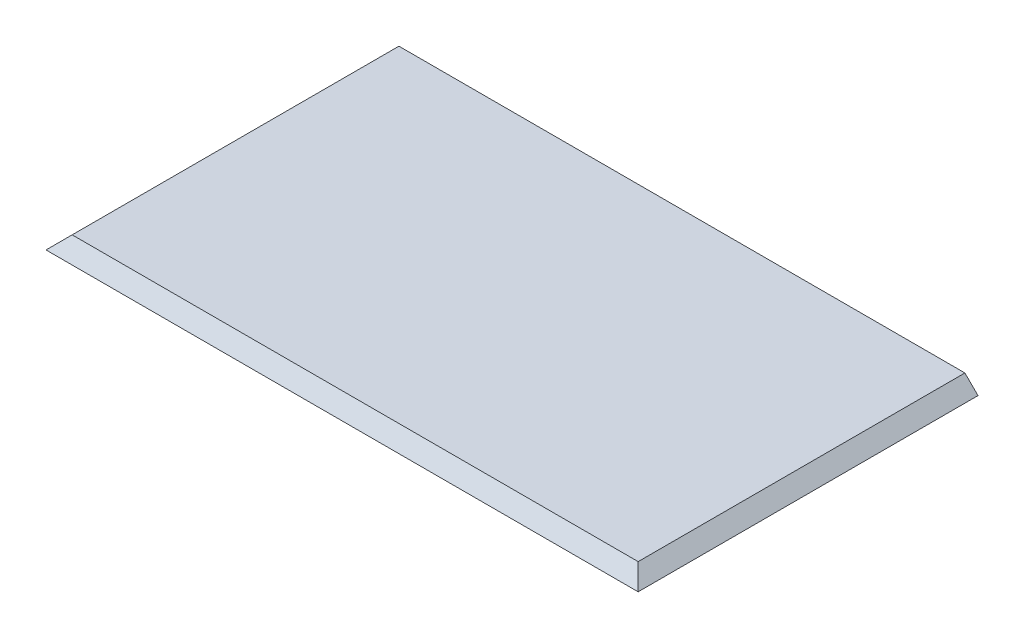
from build123d import *

# Parameters (mm, degrees)
SKETCH1_W           = 575
SKETCH1_H           = 330
BOSS_EXTRUDE1_DEPTH = 12.7
CHAMFER1_SIZE       = 12.7


with BuildPart() as part:
    # Sketch1 → Boss-Extrude1 (new body)
    with BuildSketch(Plane(origin=(0, 0, 0), x_dir=(1, 0, 0), z_dir=(0, 1, 0))):
        Rectangle(SKETCH1_W, SKETCH1_H)
    extrude(amount=BOSS_EXTRUDE1_DEPTH)

    # Chamfer1
    # the kernel refuses this chamfer: 12.7 mm, written as the material it takes off along each edge
    with BuildSketch(Plane(origin=(287.5, 12.7, -197.660373947), x_dir=(0.027495876610585654, -0.9996219169112966, 0), z_dir=(0, 0, 1)), Plane(origin=(-287.5, 12.7, 197.660373947), x_dir=(-0.027495876610585654, -0.9996219169112966, 0), z_dir=(0, 0, -1))) as chamfer1_piece_1:
        Polygon((CHAMFER1_SIZE * 0.999621916911, -CHAMFER1_SIZE * 0.0274958766106), (-CHAMFER1_SIZE * 0.0274958766106, -CHAMFER1_SIZE * 0.999621916911), (0, 0), align=None)
    extrude(amount=395.320747894, mode=Mode.SUBTRACT)
    with BuildSketch(Plane(origin=(320.160373947, 12.7, 165), x_dir=(0, -0.9996219169112966, 0.027495876610585654), z_dir=(-1, 0, 0))) as chamfer1_piece_2:
        Polygon((CHAMFER1_SIZE * 0.999621916911, -CHAMFER1_SIZE * 0.0274958766106), (-CHAMFER1_SIZE * 0.0274958766106, -CHAMFER1_SIZE * 0.999621916911), (0, 0), align=None)
    extrude(amount=640.320747894, mode=Mode.SUBTRACT)


solid = part.part
